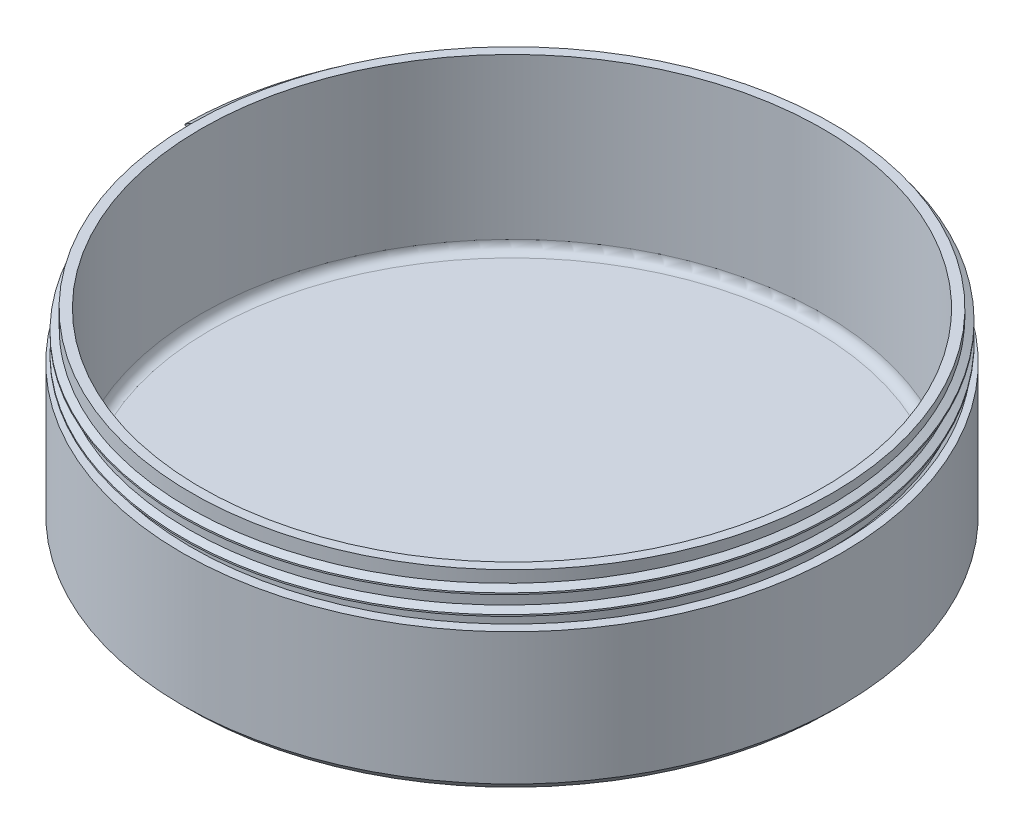
from build123d import *

# Parameters (mm, degrees)
CHAMFER_1_SIZE = 1
THREAD_1_PITCH = 2
FILLET_1_R     = 1


with BuildPart() as part:
    # Sketch 1 → Повернуть1 (revolve)
    with BuildSketch(Plane.XY):
        Polygon((0, 0), (-35, 0), (-35, 15), (-34, 15), (-34, 20), (-33, 20), (-33, 2), (0, 2), align=None)
    revolve(axis=Axis((0, 2, 0), (0, -1, 0)))

    # Фаска1
    chamfer_1_edges = [part.edges().sort_by_distance(p)[0] for p in [
        (35, 0, 0),
    ]]
    chamfer(chamfer_1_edges, length=CHAMFER_1_SIZE)

    # Резьба1: the profile of Sketch 1 2 profile screwed along a right-hand helix of 2.5 turns, 10 arcs to a turn; built about Z, then put on its axis
    thread_1_z = Axis((0, 0, 0), (0, 0, 1))
    thread_1_corners = [(33.9997, 0, -0.000173205), (34.687407661, 0, 0.396874998), (34.687407661, 0, 0.555624998), (33.9997, 0, 0.952673202)]
    with BuildLine(mode=Mode.PRIVATE) as thread_1_profile:
        Line(thread_1_corners[0], thread_1_corners[1])
        Line(thread_1_corners[1], thread_1_corners[2])
        Line(thread_1_corners[2], thread_1_corners[3])
        Line(thread_1_corners[3], thread_1_corners[0])
    thread_1_cap = Face(thread_1_profile.wire())
    thread_1_turn_angles = [0, 18, 36, 54, 72, 90, 108, 126, 144, 162, 180, 198, 216, 234, 252, 270, 288, 306, 324, 342, 360]
    thread_1_turn_weights = [1, 0.9510565162951535, 1, 0.9510565162951535, 1, 0.9510565162951535, 1, 0.9510565162951535, 1, 0.9510565162951535, 1, 0.9510565162951535, 1, 0.9510565162951535, 1, 0.9510565162951535, 1, 0.9510565162951535, 1, 0.9510565162951535, 1]
    thread_1_turn_rails = [Edge.make_bspline([Vector(p[0], p[1], 0).rotate(thread_1_z, thread_1_turn_angles[k]) / thread_1_turn_weights[k] + Vector(0, 0, p[2] + THREAD_1_PITCH * thread_1_turn_angles[k] / 360) for k in range(21)], [0, 0, 0, 1, 1, 2, 2, 3, 3, 4, 4, 5, 5, 6, 6, 7, 7, 8, 8, 9, 9, 10, 10, 10], 2, thread_1_turn_weights) for p in thread_1_corners]
    thread_1_turn_sides = [Face.make_surface_from_curves(thread_1_turn_rails[p[0]], thread_1_turn_rails[p[1]]) for p in [(0, 1), (1, 2), (2, 3), (3, 0)]]
    thread_1_last_angles = [720, 738, 756, 774, 792, 810, 828, 846, 864, 882, 900]
    thread_1_last_weights = [1, 0.9510565162951535, 1, 0.9510565162951535, 1, 0.9510565162951535, 1, 0.9510565162951535, 1, 0.9510565162951535, 1]
    thread_1_last_rails = [Edge.make_bspline([Vector(p[0], p[1], 0).rotate(thread_1_z, thread_1_last_angles[k]) / thread_1_last_weights[k] + Vector(0, 0, p[2] + THREAD_1_PITCH * thread_1_last_angles[k] / 360) for k in range(11)], [0, 0, 0, 1, 1, 2, 2, 3, 3, 4, 4, 5, 5, 5], 2, thread_1_last_weights) for p in thread_1_corners]
    thread_1_last_sides = [Face.make_surface_from_curves(thread_1_last_rails[p[0]], thread_1_last_rails[p[1]]) for p in [(0, 1), (1, 2), (2, 3), (3, 0)]]
    thread_1 = Plane(origin=(0, 20, 0), x_dir=(-1, 0, 0), z_dir=(0, -1, 0)) * Solid(Shell([*[p.moved(Location((0, 0, THREAD_1_PITCH * i))) for i in range(2) for p in thread_1_turn_sides], *thread_1_last_sides, thread_1_cap, thread_1_cap.rotate(thread_1_z, 900).moved(Location((0, 0, THREAD_1_PITCH * 900 / 360)))]))
    add(thread_1)

    # Скругление1
    fillet_1_edges = [part.edges().sort_by_distance(p)[0] for p in [
        (33, 2, 0),
    ]]
    fillet(fillet_1_edges, radius=FILLET_1_R)


solid = part.part
